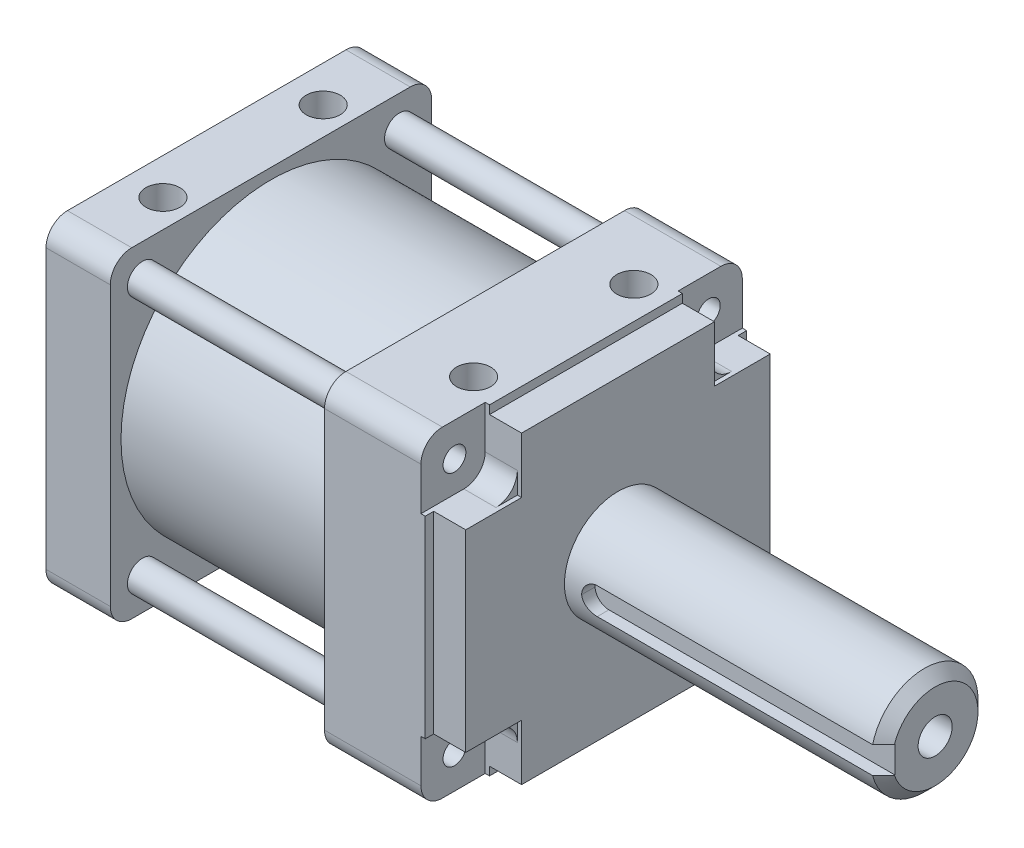
from build123d import *

# Parameters (mm, degrees)
EXTRUS_O1_DEPTH                      = 15.24
EXTRUS_O2_DEPTH                      = 3.81
ESBO_O4_R                            = 6.35
EXTRUS_O3_DEPTH                      = 38.1
ESBO_O5_R                            = 17.78
EXTRUS_O4_DEPTH                      = 25.4
ESBO_O6_R                            = 1.778
EXTRUS_O5_DEPTH                      = 25.4
EXTRUS_O6_DEPTH                      = 7.62
ESBO_O8_W                            = 3.175
ESBO_O8_H                            = 3.175
EXTRUS_O8_DEPTH                      = 35.56
FILETE5_R                            = 1.651
FILETE6_R                            = 1.651
CHANFRO1_SIZE                        = 1.27
F_10_32_TAPPED_HOLE3_D               = 4.0386
F_10_32_TAPPED_HOLE3_DEPTH           = 11.938
F_10_32_TAPPED_HOLE3_TIP             = 1.213317848
F_10_32_TAPPED_HOLE3_ON_FACE_2_D     = 4.0386
F_10_32_TAPPED_HOLE3_ON_FACE_2_DEPTH = 11.938
F_10_32_TAPPED_HOLE3_ON_FACE_2_TIP   = 1.213317848
ESBO_O17_R                           = 5.000000033
CORTE_EXTRUS_O1_DEPTH                = 2.54
F_10_32_TAPPED_HOLE1_D               = 4.0386
F_10_32_TAPPED_HOLE1_DEPTH           = 10.0000054
F_10_32_TAPPED_HOLE1_TIP             = 1.213317848
BOSS_EXTRUDE1_DEPTH                  = 0.5
F_10_32_TAPPED_HOLE2_D               = 4.0386
F_10_32_TAPPED_HOLE2_DEPTH           = 11.938
F_10_32_TAPPED_HOLE2_TIP             = 1.213317848
F_6_32_TAPPED_HOLE1_D                = 2.7051
F_6_32_TAPPED_HOLE1_DEPTH            = 9.398
F_6_32_TAPPED_HOLE1_TIP              = 0.81269403
ESBO_O18_W                           = 1
ESBO_O18_H                           = 22.86
ESBO_O18_W_2                         = 22.86
ESBO_O18_H_2                         = 1
CORTE_EXTRUS_O2_DEPTH                = 3.8


with BuildPart() as part:
    # Esboço2 → Extrusão1 (new body)
    with BuildSketch(Plane(origin=(0, 0, 0), x_dir=(0, 0, -1), z_dir=(1, 0, 0))):
        with BuildLine():
            Line((2.54, 0), (35.56, 0))
            ThreePointArc((35.56, 0), (37.356051224, 0.743948776), (38.1, 2.54))
            Line((38.1, 2.54), (38.1, 35.56))
            ThreePointArc((38.1, 35.56), (37.356051224, 37.356051224), (35.56, 38.1))
            Line((35.56, 38.1), (2.54, 38.1))
            ThreePointArc((2.54, 38.1), (0.743948776, 37.356051224), (0, 35.56))
            Line((0, 35.56), (0, 2.54))
            ThreePointArc((0, 2.54), (0.743948776, 0.743948776), (2.54, 0))
        make_face()
    extrude(amount=-EXTRUS_O1_DEPTH)

    # Esboço3 → Extrusão2 (cut)
    with BuildSketch(Plane(origin=(0, 0, 0), x_dir=(0, 0, -1), z_dir=(1, 0, 0))):
        with BuildLine():
            Line((0, 35.56), (0, 30.48))
            Line((0, 30.48), (5.08, 30.48))
            ThreePointArc((5.08, 30.48), (6.876051224, 31.223948776), (7.62, 33.02))
            Line((7.62, 33.02), (7.62, 38.1))
            Line((7.62, 38.1), (2.54, 38.1))
            ThreePointArc((2.54, 38.1), (0.743948776, 37.356051224), (0, 35.56))
        make_face()
        with BuildLine():
            ThreePointArc((0, 2.54), (0.743948776, 0.743948776), (2.54, 0))
            Line((2.54, 0), (7.62, 0))
            Line((7.62, 0), (7.62, 5.08))
            ThreePointArc((7.62, 5.08), (6.876051224, 6.876051224), (5.08, 7.62))
            Line((5.08, 7.62), (0, 7.62))
            Line((0, 7.62), (0, 2.54))
        make_face()
        with BuildLine():
            Line((30.48, 5.08), (30.48, 0))
            Line((30.48, 0), (35.56, 0))
            ThreePointArc((35.56, 0), (37.356051224, 0.743948776), (38.1, 2.54))
            Line((38.1, 2.54), (38.1, 7.62))
            Line((38.1, 7.62), (33.02, 7.62))
            ThreePointArc((33.02, 7.62), (31.223948776, 6.876051224), (30.48, 5.08))
        make_face()
        with BuildLine():
            Line((33.02, 30.48), (38.1, 30.48))
            Line((38.1, 30.48), (38.1, 35.56))
            ThreePointArc((38.1, 35.56), (37.356051224, 37.356051224), (35.56, 38.1))
            Line((35.56, 38.1), (30.48, 38.1))
            Line((30.48, 38.1), (30.48, 33.02))
            ThreePointArc((30.48, 33.02), (31.223948776, 31.223948776), (33.02, 30.48))
        make_face()
    extrude(amount=-EXTRUS_O2_DEPTH, mode=Mode.SUBTRACT)

    # Esboço4 → Extrusão3 (add)
    with BuildSketch(Plane(origin=(0, 0, 0), x_dir=(0, 0, -1), z_dir=(1, 0, 0))):
        with Locations(Location((19.05, 19.05, 0), (0, 0, 180))):
            Circle(ESBO_O4_R)
    extrude(amount=EXTRUS_O3_DEPTH)

    # Esboço5 → Extrusão4 (add)
    with BuildSketch(Plane.ZY.offset(15.24)):
        with Locations(Location((-19.05, 19.05, 0), (0, 0, 180))):
            Circle(ESBO_O5_R)
    extrude(amount=EXTRUS_O4_DEPTH)

    # Esboço6 → Extrusão5 (add)
    with BuildSketch(Plane.ZY.offset(15.24)):
        with Locations(Location((-3.81, 3.81, 0), (0, 0, 180))):
            Circle(ESBO_O6_R)
        with Locations(Location((-34.29, 3.81, 0), (0, 0, 180))):
            Circle(ESBO_O6_R)
        with Locations(Location((-3.81, 34.29, 0), (0, 0, 180))):
            Circle(ESBO_O6_R)
        with Locations(Location((-34.29, 34.29, 0), (0, 0, 180))):
            Circle(ESBO_O6_R)
    extrude(amount=EXTRUS_O5_DEPTH)

    # Esboço7 → Extrusão6 (add)
    with BuildSketch(Plane.ZY.offset(40.64)):
        with BuildLine():
            Line((-2.54, 0), (-35.56, 0))
            ThreePointArc((-35.56, 0), (-37.356051224, 0.743948776), (-38.1, 2.54))
            Line((-38.1, 2.54), (-38.1, 35.56))
            ThreePointArc((-38.1, 35.56), (-37.356051224, 37.356051224), (-35.56, 38.1))
            Line((-35.56, 38.1), (-2.54, 38.1))
            ThreePointArc((-2.54, 38.1), (-0.743948776, 37.356051224), (0, 35.56))
            Line((0, 35.56), (0, 2.54))
            ThreePointArc((0, 2.54), (-0.743948776, 0.743948776), (-2.54, 0))
        make_face()
    extrude(amount=EXTRUS_O6_DEPTH)

    # Esboço8 → Extrusão8 (cut)
    with BuildSketch(Plane(origin=(38.1, 0, 0), x_dir=(0, 0, -1), z_dir=(1, 0, 0))):
        with Locations((12.7, 19.05)):
            Rectangle(ESBO_O8_W, ESBO_O8_H)
    extrude(amount=-EXTRUS_O8_DEPTH, mode=Mode.SUBTRACT)

    # Filete5
    # the kernel refuses this fillet: 1.651 mm, written as the material it adds along each edge
    with BuildSketch(Plane(origin=(2.54, 20.6375, -8.774138938), x_dir=(0, -1, 0), z_dir=(0, 0, -1))) as filete5_piece_1_section:
        with BuildLine():
            CenterArc((FILETE5_R, -FILETE5_R), FILETE5_R, 90, 90)
            Line((0, -FILETE5_R), (0, 0))
            Line((0, 0), (FILETE5_R, 0))
        make_face()
    filete5_piece_1 = extrude(amount=9.640861062, mode=Mode.PRIVATE)
    filete5_piece_1 = filete5_piece_1 & Plane(origin=(2.54, 19.05, -19.05), x_dir=(0, 0, 1), z_dir=(-1, 0, 0)) * Cylinder(6.35, 26, mode=Mode.PRIVATE)
    add(filete5_piece_1)

    # Filete6
    # the kernel refuses this fillet: 1.651 mm, written as the material it adds along each edge
    with BuildSketch(Plane(origin=(2.54, 17.4625, -18.402770343), x_dir=(0, 1, 0), z_dir=(0, 0, 1))) as filete6_piece_1_section:
        with BuildLine():
            CenterArc((1.651, -1.646108137), FILETE6_R, 94.411725786, 85.588274214)
            Line((0, -1.646108137), (-0.03302, -1.646108137))
            Line((-0.03302, -1.646108137), (-0.03302, 0))
            Line((-0.03302, 0), (0, 0.03302))
            ThreePointArc((0, 0.03302), (0.762, 0.03302), (1.52146, 0.032922163))
            Line((1.52146, 0.032922163), (1.524, 0))
        make_face()
    filete6_piece_1 = extrude(amount=9.616401749, mode=Mode.PRIVATE)
    filete6_piece_1 = filete6_piece_1 & Plane(origin=(2.54, 19.05, -19.05), x_dir=(0, 0, 1), z_dir=(-1, 0, 0)) * Cylinder(6.35, 26, mode=Mode.PRIVATE)
    add(filete6_piece_1)

    # Chanfro1
    # the kernel refuses this chamfer: 1.27 mm, written as the material it takes off along each edge
    with BuildSketch(Plane(origin=(38.1, 19.05, -19.05), x_dir=(0, -0.003141587485879291, 0.9999950652018581), z_dir=(0, 0.9999950652018581, 0.003141587485879291))) as chanfro1_piece_1:
        Polygon((6.35, -CHANFRO1_SIZE), (6.35 - CHANFRO1_SIZE, 0), (6.35, 0), align=None)
    revolve(axis=Axis((38.1, 19.05, -19.05), (1, 0, 0)), revolution_arc=359.64, mode=Mode.SUBTRACT)

    # #10-32 Tapped Hole3
    with Locations(Plane(origin=(-7.12, 38.1, -9.54999995), x_dir=(0, 0, 1), z_dir=(0, 1, 0))):
        with Locations((0, 0), (-19.00000005, 0), (-5e-08, -36.83), (-19.0000001, -36.829999984)):
            Hole(F_10_32_TAPPED_HOLE3_D / 2, depth=F_10_32_TAPPED_HOLE3_DEPTH)
            with Locations((0, 0, -(F_10_32_TAPPED_HOLE3_DEPTH + F_10_32_TAPPED_HOLE3_TIP / 2))):  # 118° drill point
                Cone(0, F_10_32_TAPPED_HOLE3_D / 2, F_10_32_TAPPED_HOLE3_TIP, mode=Mode.SUBTRACT)

    # #10-32 Tapped Hole3 on face 2
    with Locations(Plane(origin=(-6.765900445, 0, 15.465533415), x_dir=(0, 0, 1), z_dir=(0, 1, 0))):
        with Locations((0, 0), (-1.090277919, -0.890410597)):
            Hole(F_10_32_TAPPED_HOLE3_ON_FACE_2_D / 2, depth=F_10_32_TAPPED_HOLE3_ON_FACE_2_DEPTH)
            with Locations((0, 0, -(F_10_32_TAPPED_HOLE3_ON_FACE_2_DEPTH + F_10_32_TAPPED_HOLE3_ON_FACE_2_TIP / 2))):  # 118° drill point
                Cone(0, F_10_32_TAPPED_HOLE3_ON_FACE_2_D / 2, F_10_32_TAPPED_HOLE3_ON_FACE_2_TIP, mode=Mode.SUBTRACT)

    # Esboço17 → Corte-extrusão1 (cut)
    with BuildSketch(Plane.ZY.offset(48.26)):
        with Locations((-19.05, 19.05)):
            Circle(ESBO_O17_R)
    extrude(amount=-CORTE_EXTRUS_O1_DEPTH, mode=Mode.SUBTRACT)

    # #10-32 Tapped Hole1
    with Locations(Plane(origin=(38.1, 0, 0), x_dir=(0, 0, -1), z_dir=(1, 0, 0))):
        with Locations((19.05, 19.05)):
            Hole(F_10_32_TAPPED_HOLE1_D / 2, depth=F_10_32_TAPPED_HOLE1_DEPTH)
            with Locations((0, 0, -(F_10_32_TAPPED_HOLE1_DEPTH + F_10_32_TAPPED_HOLE1_TIP / 2))):  # 118° drill point
                Cone(0, F_10_32_TAPPED_HOLE1_D / 2, F_10_32_TAPPED_HOLE1_TIP, mode=Mode.SUBTRACT)

    # Sketch4 → Boss-Extrude1 (add)
    with BuildSketch(Plane(origin=(0, 0, 0), x_dir=(0, 0, -1), z_dir=(1, 0, 0))):
        Polygon((30.48, 0), (7.62, 0), (7.62, 7.62), (0, 7.62), (0, 30.48), (7.62, 30.48), (7.62, 38.1), (30.48, 38.1), (30.48, 30.48), (38.1, 30.48), (38.1, 7.62), (30.48, 7.62), align=None)
    extrude(amount=BOSS_EXTRUDE1_DEPTH)

    # #10-32 Tapped Hole2
    with Locations(Plane.XZ):
        with Locations((-7.12, -9.55), (-7.12, -28.55), (-43.949999984, -9.55), (-43.949999984, -28.55)):
            Hole(F_10_32_TAPPED_HOLE2_D / 2, depth=F_10_32_TAPPED_HOLE2_DEPTH)
            with Locations((0, 0, -(F_10_32_TAPPED_HOLE2_DEPTH + F_10_32_TAPPED_HOLE2_TIP / 2))):  # 118° drill point
                Cone(0, F_10_32_TAPPED_HOLE2_D / 2, F_10_32_TAPPED_HOLE2_TIP, mode=Mode.SUBTRACT)

    # #6-32 Tapped Hole1
    with Locations(Plane(origin=(-3.81, 0, 0), x_dir=(0, 0, -1), z_dir=(1, 0, 0))):
        with Locations((3.975, 34.125), (34.125, 34.125), (3.975, 3.975), (34.125, 3.975)):
            Hole(F_6_32_TAPPED_HOLE1_D / 2, depth=F_6_32_TAPPED_HOLE1_DEPTH)
            with Locations((0, 0, -(F_6_32_TAPPED_HOLE1_DEPTH + F_6_32_TAPPED_HOLE1_TIP / 2))):  # 118° drill point
                Cone(0, F_6_32_TAPPED_HOLE1_D / 2, F_6_32_TAPPED_HOLE1_TIP, mode=Mode.SUBTRACT)

    # Esboço18 → Corte-extrusão2 (cut)
    with BuildSketch(Plane(origin=(0.5, 0, 0), x_dir=(0, 0, -1), z_dir=(1, 0, 0))):
        with Locations((0.5, 19.05)):
            Rectangle(ESBO_O18_W, ESBO_O18_H)
        with Locations((19.05, 37.6)):
            Rectangle(ESBO_O18_W_2, ESBO_O18_H_2)
        with Locations((37.6, 19.05)):
            Rectangle(ESBO_O18_W, ESBO_O18_H)
        with Locations((19.05, 0.5)):
            Rectangle(ESBO_O18_W_2, ESBO_O18_H_2)
    extrude(amount=-CORTE_EXTRUS_O2_DEPTH, mode=Mode.SUBTRACT)


solid = part.part
